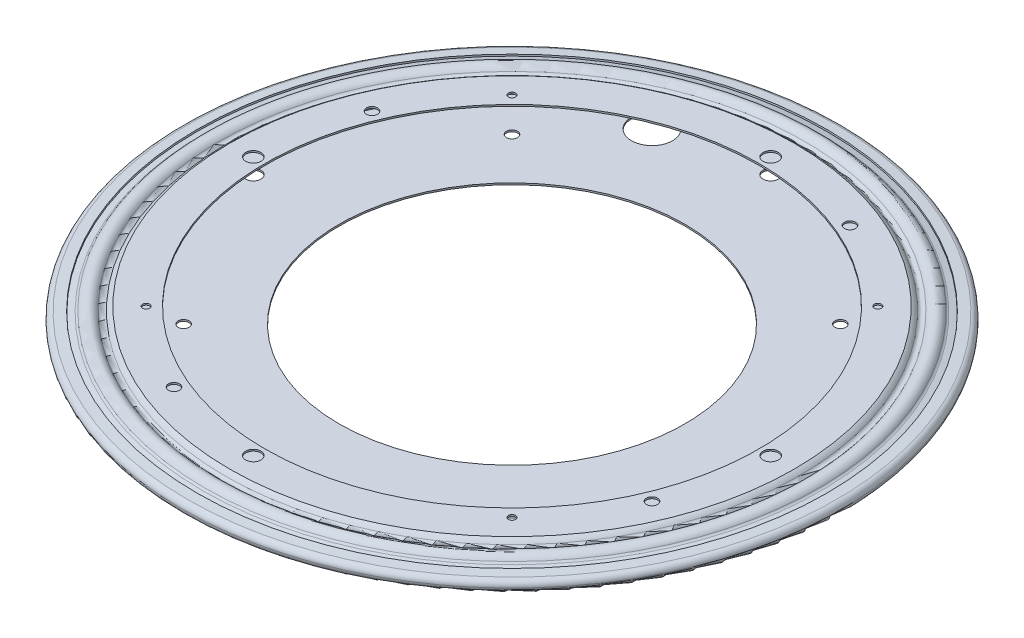
from build123d import *

# Parameters (mm, degrees)
SKETCH2_R          = 2.5781
CUT_EXTRUDE1_DEPTH = 217.77687045
CIRPATTERN1_COUNT  = 4
SKETCH3_R          = 3.5687
SKETCH3_R_2        = 2.5781
SKETCH3_R_3        = 1.651
CUT_EXTRUDE2_DEPTH = 0.762
CIRPATTERN2_COUNT  = 4
SKETCH4_R          = 9.525
CUT_EXTRUDE3_DEPTH = 217.77687045
SKETCH5_R          = 3.5687
CUT_EXTRUDE4_DEPTH = 217.77687045


# Read off the part's stored shape, not the designer's step: Revolve-Thin2
with BuildPart() as part:
    # Sketch1 → Revolve-Thin1 (revolve)
    with BuildSketch(Plane(origin=(0, 0, 0), x_dir=(0, -1, 0), z_dir=(-1, 0, 0))):
        with BuildLine():
            Line((-1.926771773, 146.408534167), (-1.578698343, 150.841931509))
            ThreePointArc((-1.578698343, 150.841931509), (1.399685714, 153.191536462), (3.9751, 150.4061))
            Line((3.9751, 150.4061), (3.9751, 147.815149845))
            ThreePointArc((3.9751, 147.815149845), (3.367531739, 146.461948013), (2.322032384, 145.409700185))
            ThreePointArc((2.322032384, 145.409700185), (1.58149611, 144.000342903), (2.306992277, 142.583184749))
            ThreePointArc((2.306992277, 142.583184749), (3.974577532, 139.281577214), (2.200826803, 136.035770497))
            ThreePointArc((2.200826803, 136.035770497), (1.534477775, 134.663377981), (2.198084705, 133.289657453))
            ThreePointArc((2.198084705, 133.289657453), (3.244200141, 132.210811353), (3.9751, 130.897779819))
            Line((3.9751, 130.897779819), (3.9751, 80.391))
            Line((3.9751, 80.391), (3.2131, 80.391))
            Line((3.2131, 80.391), (3.2131, 130.747090648))
            ThreePointArc((3.2131, 130.747090648), (2.590286323, 131.812417319), (1.725031282, 132.692276119))
            ThreePointArc((1.725031282, 132.692276119), (0.772557745, 134.681783815), (1.756830006, 136.655753124))
            ThreePointArc((1.756830006, 136.655753124), (3.212435734, 139.280692495), (1.864757335, 141.962642843))
            ThreePointArc((1.864757335, 141.962642843), (0.819506898, 144.004397507), (1.886426201, 146.034913152))
            ThreePointArc((1.886426201, 146.034913152), (2.714375531, 146.85742638), (3.2131, 147.912557654))
            Line((3.2131, 147.912557654), (3.2131, 150.4061))
            ThreePointArc((3.2131, 150.4061), (1.353761629, 152.430751072), (-0.821557443, 150.750174363))
            Line((-0.821557443, 150.750174363), (-1.167109486, 146.348891812))
            Line((-1.167109486, 146.348891812), (-1.926771773, 146.408534167))
        make_face()
    revolve(axis=Axis((0, 6.80010296, 0), (0, -1, 0)))

    # Sketch2 → Cut-Extrude1 (cut, through all)
    with BuildSketch(Plane(origin=(0, -3.2131, 0), x_dir=(-1, 0, 0), z_dir=(0, 1, 0))):
        with Locations(Location((-76.332177029, -76.332177029, 0), (0, 0, 90))):
            Circle(SKETCH2_R)
    cut_extrude1 = extrude(amount=-CUT_EXTRUDE1_DEPTH, mode=Mode.SUBTRACT)

    # CirPattern1: Cut-Extrude1 ×4 about axis
    cirpattern1_axis = Axis((0, 0, 0), (0, 1, 0))
    for i in range(1, CIRPATTERN1_COUNT):
        add(cut_extrude1.rotate(cirpattern1_axis, i * 360 / CIRPATTERN1_COUNT), mode=Mode.SUBTRACT)

    # Sketch4 → Cut-Extrude3 (cut, through all)
    with BuildSketch(Plane(origin=(0, -3.2131, 0), x_dir=(-1, 0, 0), z_dir=(0, 1, 0))):
        with Locations(Location((-46.020093648, 111.102334226, 0), (0, 0, 90))):
            Circle(SKETCH4_R)
        with Locations(Location((46.020093648, -111.102334226, 0), (0, 0, 90))):
            Circle(SKETCH4_R)
    extrude(amount=-CUT_EXTRUDE3_DEPTH, mode=Mode.SUBTRACT)

    # Sketch5 → Cut-Extrude4 (cut, through all)
    with BuildSketch(Plane(origin=(0, -3.2131, 0), x_dir=(-1, 0, 0), z_dir=(0, 1, 0))):
        with Locations(Location((120.2563, 0, 0), (0, 0, 90))):
            Circle(SKETCH5_R)
        with Locations(Location((0, -120.2563, 0), (0, 0, 90))):
            Circle(SKETCH5_R)
        with Locations(Location((-120.2563, 0, 0), (0, 0, 90))):
            Circle(SKETCH5_R)
        with Locations(Location((0, 120.2563, 0), (0, 0, 90))):
            Circle(SKETCH5_R)
    extrude(amount=-CUT_EXTRUDE4_DEPTH, mode=Mode.SUBTRACT)


with BuildPart() as body_2:
    # Revolve-Thin2 outline → Revolve-Thin2 (revolve)
    with BuildSketch(Plane.XY):
        with BuildLine():
            ThreePointArc((142.077060046, 1.692765877), (142.65188466, 1.065763639), (143.416148645, 0.692325956))
            Line((143.416148645, 0.692325956), (148.686281745, -0.75128688))
            Line((148.686281745, -0.75128688), (148.887595299, -0.016360453))
            Line((148.887595299, -0.016360453), (143.617462199, 1.427252383))
            ThreePointArc((143.617462199, 1.427252383), (143.107952875, 1.676210838), (142.724736466, 2.09421233))
            ThreePointArc((142.724736466, 2.09421233), (139.446585641, 3.97382781), (136.077560973, 2.262424884))
            ThreePointArc((136.077560973, 2.262424884), (134.70886921, 1.529864297), (133.31533326, 2.213983958))
            ThreePointArc((133.31533326, 2.213983958), (132.367450236, 3.217414), (131.213645225, 3.9751))
            Line((131.213645225, 3.9751), (114.8969, 3.9751))
            Line((114.8969, 3.9751), (114.8969, 3.2131))
            Line((114.8969, 3.2131), (131.026798797, 3.2131))
            ThreePointArc((131.026798797, 3.2131), (131.944426003, 2.576771343), (132.704382538, 1.758590486))
            ThreePointArc((132.704382538, 1.758590486), (134.722230277, 0.767981444), (136.704103497, 1.828733213))
            ThreePointArc((136.704103497, 1.828733213), (139.42730874, 3.21207168), (142.077060046, 1.692765877))
        make_face()
    revolve(axis=Axis((0, 0, 0), (0, 1, 0)))

    # Sketch3 → Cut-Extrude2 (cut)
    with BuildSketch(Plane(origin=(0, 3.9751, 0), x_dir=(-1, 0, 0), z_dir=(0, 1, 0))):
        with Locations(Location((0, -120.2563, 0), (0, 0, 90))):
            Circle(SKETCH3_R)
        with Locations(Location((-46.020093648, -111.102334226, 0), (0, 0, 90))):
            Circle(SKETCH3_R_2)
        with Locations(Location((-85.03404521, -85.03404521, 0), (0, 0, 90))):
            Circle(SKETCH3_R_3)
    cut_extrude2 = extrude(amount=-CUT_EXTRUDE2_DEPTH, mode=Mode.SUBTRACT)

    # CirPattern2: Cut-Extrude2 ×4 about axis
    cirpattern2_axis = Axis((0, 0, 0), (0, 1, 0))
    for i in range(1, CIRPATTERN2_COUNT):
        add(cut_extrude2.rotate(cirpattern2_axis, i * 360 / CIRPATTERN2_COUNT), mode=Mode.SUBTRACT)


solid = Compound([part.part, body_2.part])
